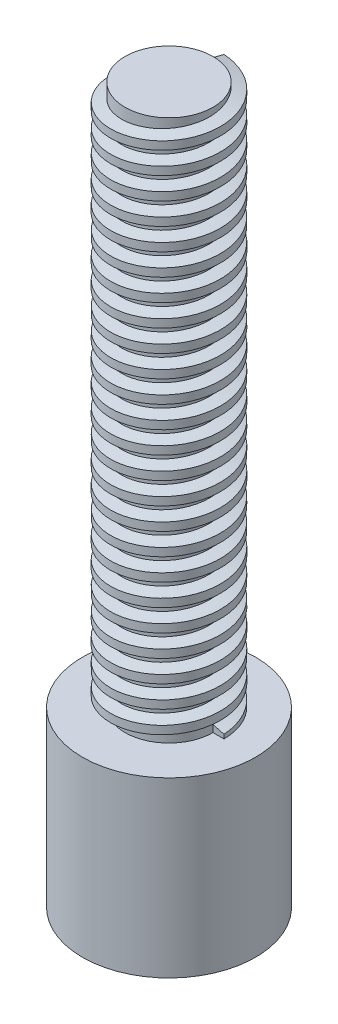
from build123d import *

# Parameters (mm, degrees)
SKETCH1_R           = 12.7
BOSS_EXTRUDE1_DEPTH = 125
SKETCH9_R           = 12.7
SKETCH9_R_2         = 10.16
CUT_EXTRUDE1_DEPTH  = 285.4
SWEEP1_PITCH        = 5.08
SKETCH2_R           = 20
BOSS_EXTRUDE2_DEPTH = 40
CUT_EXTRUDE2_DEPTH  = 19.05
FILLET1_R           = 1


with BuildPart() as part:
    # Sketch1 → Boss-Extrude1 (new body)
    with BuildSketch(Plane(origin=(0, 0, 0), x_dir=(1, 0, 0), z_dir=(0, 1, 0))):
        with Locations(Location((0, 0, 0), (0, 0, 270))):
            Circle(SKETCH1_R)
    extrude(amount=BOSS_EXTRUDE1_DEPTH)

    # Sketch9 → Cut-Extrude1 (cut)
    with BuildSketch(Plane.XZ):
        Circle(SKETCH9_R)
        with Locations(Location((0, 0, 0), (0, 0, 270))):
            Circle(SKETCH9_R_2, mode=Mode.SUBTRACT)
    extrude(amount=-CUT_EXTRUDE1_DEPTH, mode=Mode.SUBTRACT)

    # Sweep1: arcs per turn and ends read off the stored shape
    # Sweep1: the profile of Sketch10 profile screwed along a right-hand helix through 24.25 turns, 12 arcs to a turn; built about Z, then put on its axis
    sweep1_z = Axis((0, 0, 0), (0, 0, 1))
    sweep1_corners = [(10.1597, 0, -1.598521917), (10.1597, 0, 1.598521917), (12.7, 0, 0.941555668), (12.7, 0, -0.941555668)]
    with BuildLine(mode=Mode.PRIVATE) as sweep1_profile:
        Line(sweep1_corners[0], sweep1_corners[1])
        Line(sweep1_corners[1], sweep1_corners[2])
        Line(sweep1_corners[2], sweep1_corners[3])
        Line(sweep1_corners[3], sweep1_corners[0])
    sweep1_cap = Face(sweep1_profile.wire())
    sweep1_turn_angles = [0, 15, 30, 45, 60, 75, 90, 105, 120, 135, 150, 165, 180, 195, 210, 225, 240, 255, 270, 285, 300, 315, 330, 345, 360]
    sweep1_turn_weights = [1, 0.9659258262890683, 1, 0.9659258262890683, 1, 0.9659258262890683, 1, 0.9659258262890683, 1, 0.9659258262890683, 1, 0.9659258262890683, 1, 0.9659258262890683, 1, 0.9659258262890683, 1, 0.9659258262890683, 1, 0.9659258262890683, 1, 0.9659258262890683, 1, 0.9659258262890683, 1]
    sweep1_turn_rails = [Edge.make_bspline([Vector(p[0], p[1], 0).rotate(sweep1_z, sweep1_turn_angles[k]) / sweep1_turn_weights[k] + Vector(0, 0, p[2] + SWEEP1_PITCH * sweep1_turn_angles[k] / 360) for k in range(25)], [0, 0, 0, 1, 1, 2, 2, 3, 3, 4, 4, 5, 5, 6, 6, 7, 7, 8, 8, 9, 9, 10, 10, 11, 11, 12, 12, 12], 2, sweep1_turn_weights) for p in sweep1_corners]
    sweep1_turn_sides = [Face.make_surface_from_curves(sweep1_turn_rails[p[0]], sweep1_turn_rails[p[1]]) for p in [(0, 1), (1, 2), (2, 3), (3, 0)]]
    sweep1_last_angles = [8640, 8655, 8670, 8685, 8700, 8715, 8730]
    sweep1_last_weights = [1, 0.9659258262890683, 1, 0.9659258262890683, 1, 0.9659258262888794, 1]
    sweep1_last_rails = [Edge.make_bspline([Vector(p[0], p[1], 0).rotate(sweep1_z, sweep1_last_angles[k]) / sweep1_last_weights[k] + Vector(0, 0, p[2] + SWEEP1_PITCH * sweep1_last_angles[k] / 360) for k in range(7)], [0, 0, 0, 1, 1, 2, 2, 3, 3, 3], 2, sweep1_last_weights) for p in sweep1_corners]
    sweep1_last_sides = [Face.make_surface_from_curves(sweep1_last_rails[p[0]], sweep1_last_rails[p[1]]) for p in [(0, 1), (1, 2), (2, 3), (3, 0)]]
    sweep1 = Plane(origin=(0, 0, 0), x_dir=(1, 0, 0), z_dir=(0, 1, 0)) * Solid(Shell([*[p.moved(Location((0, 0, SWEEP1_PITCH * i))) for i in range(24) for p in sweep1_turn_sides], *sweep1_last_sides, sweep1_cap, sweep1_cap.rotate(sweep1_z, 8730).moved(Location((0, 0, SWEEP1_PITCH * 8730 / 360)))]))
    add(sweep1)

    # Sketch2 → Boss-Extrude2 (add)
    with BuildSketch(Plane.XZ):
        with Locations(Location((0, 0, 0), (0, 0, 270))):
            Circle(SKETCH2_R)
    extrude(amount=BOSS_EXTRUDE2_DEPTH)

    # Sketch11 → Cut-Extrude2 (cut)
    with BuildSketch(Plane.XZ.offset(40)):
        Polygon((-2.96875, -3.96875), (-3.96875, -2.96875), (-3.96875, 2.96875), (-2.96875, 3.96875), (2.96875, 3.96875), (3.96875, 2.96875), (3.96875, -2.96875), (2.96875, -3.96875), align=None)
    extrude(amount=-CUT_EXTRUDE2_DEPTH, mode=Mode.SUBTRACT)

    # Fillet1
    fillet1_edges = [part.edges().sort_by_distance(p)[0] for p in [
        (0, -40, -3.96875),
        (3.46875, -40, -3.46875),
        (3.96875, -40, 0),
        (3.46875, -40, 3.46875),
        (0, -40, 3.96875),
        (-3.46875, -40, 3.46875),
        (-3.96875, -40, 0),
        (-3.46875, -40, -3.46875),
    ]]
    fillet(fillet1_edges, radius=FILLET1_R)


solid = part.part
